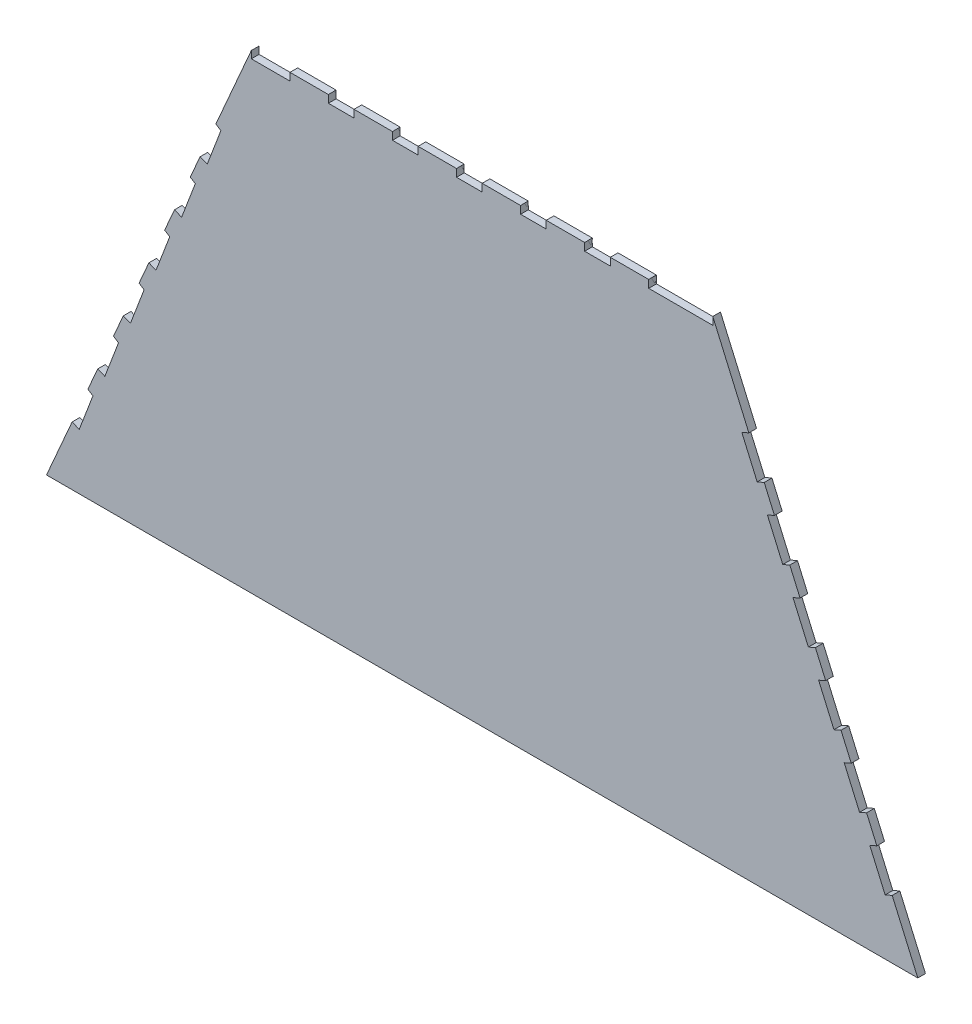
from build123d import *

# Parameters (mm, degrees)
BOSS_EXTRUDE1_DEPTH = 3
CUT_EXTRUDE2_DEPTH  = 3
LPATTERN2_COUNT     = 6
LPATTERN2_PITCH     = 25
CUT_EXTRUDE3_DEPTH  = 3
LPATTERN3_COUNT     = 6
LPATTERN3_PITCH     = 25
CAVITY4_START       = 94.102573719
CAVITY4_DEPTH       = 3
SKETCH4_W           = 10
SKETCH4_H           = 3
SKETCH4_W_2         = 15.058056796
SKETCH4_H_2         = 3.003228899
CUT_EXTRUDE5_DEPTH  = 10


# Read off the part's stored shape, not the designer's step: Cavity4
with BuildPart() as part:
    # Sketch1 → Boss-Extrude1 (new body)
    with BuildSketch(Plane.XY):
        Polygon((-182.169109633, -75.86705578), (157.830890367, -75.86705578), (77.830890367, 107.708711956), (-102.169109633, 107.708711956), align=None)
    extrude(amount=BOSS_EXTRUDE1_DEPTH)

    # Sketch2 → Cut-Extrude2 (cut)
    with BuildSketch(Plane.XY.offset(3)):
        Polygon((-172.181594028, -52.948732717), (-169.400999714, -54.074918874), (-164.054462817, -40.06012158), (-166.030438991, -38.833695112), align=None)
    cut_extrude2 = extrude(amount=-CUT_EXTRUDE2_DEPTH, mode=Mode.SUBTRACT)

    # LPattern2: Cut-Extrude2 ×6
    with Locations(*[Vector(0.3995006242197252, 0.916732922528721, 0) * (i * LPATTERN2_PITCH) for i in range(1, LPATTERN2_COUNT)]):
        add(cut_extrude2, mode=Mode.SUBTRACT)

    # Sketch3 → Cut-Extrude3 (cut)
    with BuildSketch(Plane.XY.offset(3)):
        Polygon((147.843374761, -52.948732717), (141.850865398, -39.197738879), (139.10066663, -40.396240752), (145.093175994, -54.14723459), align=None)
    cut_extrude3 = extrude(amount=-CUT_EXTRUDE3_DEPTH, mode=Mode.SUBTRACT)

    # LPattern3: Cut-Extrude3 ×6
    with Locations(*[Vector(-0.3995006242197251, 0.9167329225287211, 0) * (i * LPATTERN3_PITCH) for i in range(1, LPATTERN3_COUNT)]):
        add(cut_extrude3, mode=Mode.SUBTRACT)

    # Cavity4 outline → Cavity4 (cut)
    with BuildSketch(Plane(origin=(0, 0, 0), x_dir=(0.9999532933915303, -0.008562000513036364, -0.004483657284732639), z_dir=(0.009664938459823271, 0.8858411925353571, 0.46388788577856205)).offset(CAVITY4_START)):
        Polygon((-103.131187753, 49.679443772), (-88.131836909, 49.53989356), (-88.127862283, 49.967100463), (-88.118252444, 51), (-103.118901627, 51), (-103.12893984, 49.921057402), align=None)
        Polygon((-63.117170469, 51), (-73.117603258, 51), (-73.127213098, 49.967100463), (-73.132486065, 49.400343349), (-63.132918836, 49.307309875), (-63.126780309, 49.967100463), align=None)
        Polygon((-38.116088496, 51), (-48.116521286, 51), (-48.126131125, 49.967100463), (-48.133567992, 49.167759664), (-38.134000762, 49.07472619), (-38.125698335, 49.967100463), align=None)
        Polygon((-13.115006523, 51), (-23.115439311, 51), (-23.125049151, 49.967100463), (-23.134649919, 48.935175979), (-13.135082689, 48.842142504), (-13.124616362, 49.967100463), align=None)
        Polygon((76.879278743, 49.967100463), (76.888888582, 51), (51.887806609, 51), (51.87819677, 49.967100463), (51.862104301, 48.237424923), (76.861022374, 48.004841237), align=None)
        Polygon((11.886075451, 51), (1.885642662, 51), (1.876032823, 49.967100463), (1.864268155, 48.702592293), (11.863835384, 48.609558819), (11.876465612, 49.967100463), align=None)
        Polygon((36.877547586, 49.967100463), (36.887157425, 51), (26.886724635, 51), (26.877114796, 49.967100463), (26.863186228, 48.470008608), (36.862753457, 48.376975134), align=None)
    extrude(amount=CAVITY4_DEPTH, mode=Mode.SUBTRACT)

    # Sketch4 → Cut-Extrude5 (cut)
    with BuildSketch(Plane(origin=(0, 0, 0), x_dir=(-1, 0, 0), z_dir=(0, 0, -1))):
        Polygon((-77.830853836, 107.708711956), (-77.830853836, 104.708711956), (-52.830853836, 104.708711956), (-52.795526537, 107.708711956), align=None)
        with Locations((-32.830890367, 106.241816524)):
            Rectangle(SKETCH4_W, SKETCH4_H)
        with Locations((-7.830890367, 106.241816524)):
            Rectangle(SKETCH4_W, SKETCH4_H)
        with Locations((17.169109633, 106.241816524)):
            Rectangle(SKETCH4_W, SKETCH4_H)
        with Locations((42.169109633, 106.241816524)):
            Rectangle(SKETCH4_W, SKETCH4_H)
        with Locations((67.169109633, 106.241816524)):
            Rectangle(SKETCH4_W, SKETCH4_H)
        with Locations((94.698138031, 106.243430974)):
            Rectangle(SKETCH4_W_2, SKETCH4_H_2)
    extrude(amount=-CUT_EXTRUDE5_DEPTH, mode=Mode.SUBTRACT)


solid = part.part
